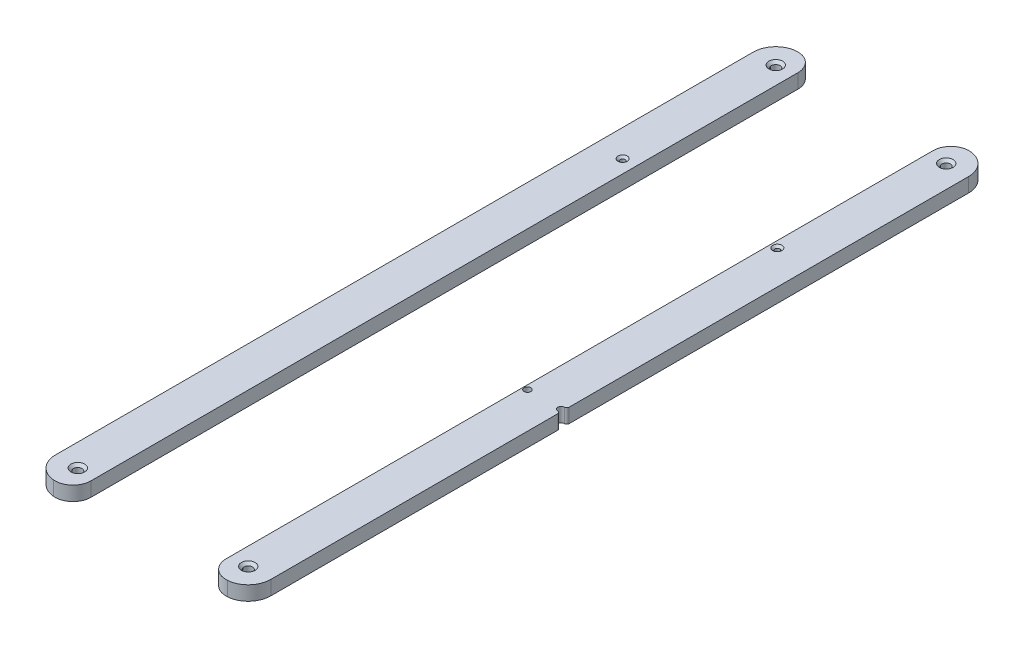
from build123d import *

# Parameters (mm, degrees)
SKETCH2_W                        = 150
SKETCH2_H                        = 330
SKETCH2_R                        = 2
BOSS_EXTRUDE1_DEPTH              = 6.35
SKETCH4_R                        = 7
SKETCH4_R_2                      = 1.5
CUT_EXTRUDE1_DEPTH               = 182.356892618
SKETCH7_R                        = 1.5
CUT_EXTRUDE2_DEPTH               = 10
SKETCH8_OUTSIDE_W                = 224.51
SKETCH8_OUTSIDE_H                = 404.51
SKETCH8_OUTSIDE_R                = 2
SKETCH8_OUTSIDE_R_2              = 7
SKETCH8_OUTSIDE_R_3              = 1.5
CUT_EXTRUDE3_DEPTH               = 10
FILLET2_R                        = 8
CUT_EXTRUDE7_DEPTH               = 10
SKETCH20_R                       = 1.5
CUT_EXTRUDE12_DEPTH              = 36.83
SKETCH18_R                       = 1.35
CUT_EXTRUDE10_DEPTH              = 36.83
CUT_EXTRUDE11_DEPTH              = 36.83
SKETCH21_OUTSIDE_W               = 204.398
SKETCH21_OUTSIDE_H               = 403.048
SKETCH21_OUTSIDE_W_2             = 95.7
SKETCH21_OUTSIDE_H_2             = 330
CUT_EXTRUDE13_DEPTH              = 182.356892618
F_4_40_TAPPED_HOLE1_D            = 2.2606
F_4_40_TAPPED_HOLE1_CSINK_D      = 4.1148
F_4_40_TAPPED_HOLE1_CSINK_ANGLE  = 90
F_4_40_TAPPED_HOLE2_D            = 2.2606
F_4_40_TAPPED_HOLE2_CSINK_D      = 4.1148
F_4_40_TAPPED_HOLE2_CSINK_ANGLE  = 90
FILLET11_R                       = 10
F_10_24_TAPPED_HOLE2_D           = 3.7973
F_10_24_TAPPED_HOLE2_CSINK_D     = 6.096
F_10_24_TAPPED_HOLE2_CSINK_ANGLE = 90
FILLET14_R                       = 1
SKETCH35_W                       = 60
SKETCH35_H                       = 330
CUT_EXTRUDE16_DEPTH              = 172.915517043
FILLET15_R                       = 8
FILLET16_R                       = 8


with BuildPart() as part:
    # Sketch2 → Boss-Extrude1 (new body)
    with BuildSketch(Plane(origin=(0, 0, 0), x_dir=(1, 0, 0), z_dir=(0, 1, 0))):
        Rectangle(SKETCH2_W, SKETCH2_H)
        with Locations((-50, 129.505)):
            Circle(SKETCH2_R, mode=Mode.SUBTRACT)
        with Locations((50, 129.505)):
            Circle(SKETCH2_R, mode=Mode.SUBTRACT)
        with Locations((50, 64.505)):
            Circle(SKETCH2_R, mode=Mode.SUBTRACT)
        with Locations((-50, 64.505)):
            Circle(SKETCH2_R, mode=Mode.SUBTRACT)
        with Locations((50, -129.505)):
            Circle(SKETCH2_R, mode=Mode.SUBTRACT)
        with Locations((-50, -129.505)):
            Circle(SKETCH2_R, mode=Mode.SUBTRACT)
        with Locations((-50, -64.505)):
            Circle(SKETCH2_R, mode=Mode.SUBTRACT)
        with Locations((50, -64.505)):
            Circle(SKETCH2_R, mode=Mode.SUBTRACT)
    extrude(amount=BOSS_EXTRUDE1_DEPTH)

    # Sketch4 → Cut-Extrude1 (cut, through all)
    with BuildSketch(Plane(origin=(0, 6.35, 0), x_dir=(1, 0, 0), z_dir=(0, 1, 0))):
        with Locations((1.85, -25)):
            Circle(SKETCH4_R)
        with Locations((-1.15, 25)):
            Circle(SKETCH4_R)
        with Locations((-4.15, 75)):
            Circle(SKETCH4_R)
        with Locations((-7.15, 125)):
            Circle(SKETCH4_R)
        with Locations((13, -70)):
            Circle(SKETCH4_R_2)
        with Locations((16, -90)):
            Circle(SKETCH4_R_2)
        with Locations((19, -110)):
            Circle(SKETCH4_R_2)
        with Locations((22, -130)):
            Circle(SKETCH4_R_2)
    extrude(amount=-CUT_EXTRUDE1_DEPTH, mode=Mode.SUBTRACT)

    # Sketch7 → Cut-Extrude2 (cut)
    with BuildSketch(Plane(origin=(0, 6.35, 0), x_dir=(1, 0, 0), z_dir=(0, 1, 0))):
        with Locations((31.85, -25)):
            Circle(SKETCH7_R)
        with Locations((46.85, -25)):
            Circle(SKETCH7_R)
        with Locations((61.85, -25)):
            Circle(SKETCH7_R)
    extrude(amount=-CUT_EXTRUDE2_DEPTH, mode=Mode.SUBTRACT)

    # Sketch8 outside → Cut-Extrude3 (cut)
    # profile 1 of 20: a face of its own
    with BuildSketch(Plane(origin=(0, 6.35, 0), x_dir=(1, 0, 0), z_dir=(0, 1, 0))):
        Rectangle(SKETCH8_OUTSIDE_W, SKETCH8_OUTSIDE_H)
        Polygon((-56.35, 165), (-56.35, -165), (56.35, -165), (56.35, -42.5), (75, -42.5), (75, -7.5), (56.35, -7.5), (56.35, 165), align=None, mode=Mode.SUBTRACT)
    # profile 2 of 20: a face of its own
    with BuildSketch(Plane(origin=(0, 6.35, 0), x_dir=(1, 0, 0), z_dir=(0, 1, 0))):
        with Locations((-50, -129.505)):
            Circle(SKETCH8_OUTSIDE_R)
    # profile 3 of 20: a face of its own
    with BuildSketch(Plane(origin=(0, 6.35, 0), x_dir=(1, 0, 0), z_dir=(0, 1, 0))):
        with Locations((-50, -64.505)):
            Circle(SKETCH8_OUTSIDE_R)
    # profile 4 of 20: a face of its own
    with BuildSketch(Plane(origin=(0, 6.35, 0), x_dir=(1, 0, 0), z_dir=(0, 1, 0))):
        with Locations((1.85, -25)):
            Circle(SKETCH8_OUTSIDE_R_2)
    # profile 5 of 20: a face of its own
    with BuildSketch(Plane(origin=(0, 6.35, 0), x_dir=(1, 0, 0), z_dir=(0, 1, 0))):
        with Locations((22, -130)):
            Circle(SKETCH8_OUTSIDE_R_3)
    # profile 6 of 20: a face of its own
    with BuildSketch(Plane(origin=(0, 6.35, 0), x_dir=(1, 0, 0), z_dir=(0, 1, 0))):
        with Locations((19, -110)):
            Circle(SKETCH8_OUTSIDE_R_3)
    # profile 7 of 20: a face of its own
    with BuildSketch(Plane(origin=(0, 6.35, 0), x_dir=(1, 0, 0), z_dir=(0, 1, 0))):
        with Locations((16, -90)):
            Circle(SKETCH8_OUTSIDE_R_3)
    # profile 8 of 20: a face of its own
    with BuildSketch(Plane(origin=(0, 6.35, 0), x_dir=(1, 0, 0), z_dir=(0, 1, 0))):
        with Locations((50, -129.505)):
            Circle(SKETCH8_OUTSIDE_R)
    # profile 9 of 20: a face of its own
    with BuildSketch(Plane(origin=(0, 6.35, 0), x_dir=(1, 0, 0), z_dir=(0, 1, 0))):
        with Locations((13, -70)):
            Circle(SKETCH8_OUTSIDE_R_3)
    # profile 10 of 20: a face of its own
    with BuildSketch(Plane(origin=(0, 6.35, 0), x_dir=(1, 0, 0), z_dir=(0, 1, 0))):
        with Locations((50, -64.505)):
            Circle(SKETCH8_OUTSIDE_R)
    # profile 11 of 20: a face of its own
    with BuildSketch(Plane(origin=(0, 6.35, 0), x_dir=(1, 0, 0), z_dir=(0, 1, 0))):
        with Locations((-50, 64.505)):
            Circle(SKETCH8_OUTSIDE_R)
    # profile 12 of 20: a face of its own
    with BuildSketch(Plane(origin=(0, 6.35, 0), x_dir=(1, 0, 0), z_dir=(0, 1, 0))):
        with Locations((-1.15, 25)):
            Circle(SKETCH8_OUTSIDE_R_2)
    # profile 13 of 20: a face of its own
    with BuildSketch(Plane(origin=(0, 6.35, 0), x_dir=(1, 0, 0), z_dir=(0, 1, 0))):
        with Locations((-4.15, 75)):
            Circle(SKETCH8_OUTSIDE_R_2)
    # profile 14 of 20: a face of its own
    with BuildSketch(Plane(origin=(0, 6.35, 0), x_dir=(1, 0, 0), z_dir=(0, 1, 0))):
        with Locations((-50, 129.505)):
            Circle(SKETCH8_OUTSIDE_R)
    # profile 15 of 20: a face of its own
    with BuildSketch(Plane(origin=(0, 6.35, 0), x_dir=(1, 0, 0), z_dir=(0, 1, 0))):
        with Locations((-7.15, 125)):
            Circle(SKETCH8_OUTSIDE_R_2)
    # profile 16 of 20: a face of its own
    with BuildSketch(Plane(origin=(0, 6.35, 0), x_dir=(1, 0, 0), z_dir=(0, 1, 0))):
        with Locations((50, 64.505)):
            Circle(SKETCH8_OUTSIDE_R)
    # profile 17 of 20: a face of its own
    with BuildSketch(Plane(origin=(0, 6.35, 0), x_dir=(1, 0, 0), z_dir=(0, 1, 0))):
        with Locations((50, 129.505)):
            Circle(SKETCH8_OUTSIDE_R)
    # profile 18 of 20: a face of its own
    with BuildSketch(Plane(origin=(0, 6.35, 0), x_dir=(1, 0, 0), z_dir=(0, 1, 0))):
        with Locations((31.85, -25)):
            Circle(SKETCH8_OUTSIDE_R_3)
    # profile 19 of 20: a face of its own
    with BuildSketch(Plane(origin=(0, 6.35, 0), x_dir=(1, 0, 0), z_dir=(0, 1, 0))):
        with Locations((46.85, -25)):
            Circle(SKETCH8_OUTSIDE_R_3)
    # profile 20 of 20: a face of its own
    with BuildSketch(Plane(origin=(0, 6.35, 0), x_dir=(1, 0, 0), z_dir=(0, 1, 0))):
        with Locations((61.85, -25)):
            Circle(SKETCH8_OUTSIDE_R_3)
    extrude(amount=-CUT_EXTRUDE3_DEPTH, mode=Mode.SUBTRACT)

    # Fillet2
    fillet2_edges = [part.edges().sort_by_distance(p)[0] for p in [
        (-56.35, 3.175, 165),
        (56.35, 3.175, 165),
        (-56.35, 3.175, -165),
        (56.35, 3.175, -165),
        (56.35, 3.175, 7.5),
        (75, 3.175, 7.5),
        (56.35, 3.175, 42.5),
        (75, 3.175, 42.5),
    ]]
    fillet(fillet2_edges, radius=FILLET2_R)

    # Sketch15 → Cut-Extrude7 (cut)
    with BuildSketch(Plane(origin=(0, 6.35, 0), x_dir=(1, 0, 0), z_dir=(0, 1, 0))):
        with BuildLine():
            Line((-52, -134.505), (-52, -124.505))
            ThreePointArc((-52, -124.505), (-50, -122.505), (-48, -124.505))
            Line((-48, -124.505), (-48, -134.505))
            ThreePointArc((-48, -134.505), (-50, -136.505), (-52, -134.505))
        make_face()
        with BuildLine():
            Line((48, -134.505), (48, -124.505))
            ThreePointArc((48, -124.505), (50, -122.505), (52, -124.505))
            Line((52, -124.505), (52, -134.505))
            ThreePointArc((52, -134.505), (50, -136.505), (48, -134.505))
        make_face()
        with BuildLine():
            Line((48, -69.505), (48, -59.505))
            ThreePointArc((48, -59.505), (50, -57.505), (52, -59.505))
            Line((52, -59.505), (52, -69.505))
            ThreePointArc((52, -69.505), (50, -71.505), (48, -69.505))
        make_face()
        with BuildLine():
            Line((-52, -69.505), (-52, -59.505))
            ThreePointArc((-52, -59.505), (-50, -57.505), (-48, -59.505))
            Line((-48, -59.505), (-48, -69.505))
            ThreePointArc((-48, -69.505), (-50, -71.505), (-52, -69.505))
        make_face()
        with BuildLine():
            Line((-52, 134.505), (-52, 124.505))
            ThreePointArc((-52, 124.505), (-50, 122.505), (-48, 124.505))
            Line((-48, 124.505), (-48, 134.505))
            ThreePointArc((-48, 134.505), (-50, 136.505), (-52, 134.505))
        make_face()
        with BuildLine():
            Line((48, 134.505), (48, 124.505))
            ThreePointArc((48, 124.505), (50, 122.505), (52, 124.505))
            Line((52, 124.505), (52, 134.505))
            ThreePointArc((52, 134.505), (50, 136.505), (48, 134.505))
        make_face()
        with BuildLine():
            Line((48, 69.505), (48, 59.505))
            ThreePointArc((48, 59.505), (50, 57.505), (52, 59.505))
            Line((52, 59.505), (52, 69.505))
            ThreePointArc((52, 69.505), (50, 71.505), (48, 69.505))
        make_face()
        with BuildLine():
            Line((-52, 69.505), (-52, 59.505))
            ThreePointArc((-52, 59.505), (-50, 57.505), (-48, 59.505))
            Line((-48, 59.505), (-48, 69.505))
            ThreePointArc((-48, 69.505), (-50, 71.505), (-52, 69.505))
        make_face()
    extrude(amount=-CUT_EXTRUDE7_DEPTH, mode=Mode.SUBTRACT)

    # Sketch20 → Cut-Extrude12 (cut)
    with BuildSketch(Plane(origin=(0, 6.35, 0), x_dir=(1, 0, 0), z_dir=(0, 1, 0))):
        with Locations((-50, -144.505)):
            Circle(SKETCH20_R)
        with Locations((-50, -79.505)):
            Circle(SKETCH20_R)
        with Locations((50, -79.505)):
            Circle(SKETCH20_R)
        with Locations((50, -144.505)):
            Circle(SKETCH20_R)
        with Locations((50, 144.505)):
            Circle(SKETCH20_R)
        with Locations((50, 79.505)):
            Circle(SKETCH20_R)
        with Locations((-50, 79.505)):
            Circle(SKETCH20_R)
        with Locations((-50, 144.505)):
            Circle(SKETCH20_R)
    extrude(amount=-CUT_EXTRUDE12_DEPTH, mode=Mode.SUBTRACT)

    # Sketch18 → Cut-Extrude10 (cut)
    with BuildSketch(Plane(origin=(0, 6.35, 0), x_dir=(1, 0, 0), z_dir=(0, 1, 0))):
        with Locations((14.35, -33.5)):
            Circle(SKETCH18_R)
        with Locations((-10.65, -33.5)):
            Circle(SKETCH18_R)
        with Locations((14.35, -4.5)):
            Circle(SKETCH18_R)
        with Locations((-10.65, -4.5)):
            Circle(SKETCH18_R)
        with Locations((-13.65, 16.5)):
            Circle(SKETCH18_R)
        with Locations((-13.65, 45.5)):
            Circle(SKETCH18_R)
        with Locations((-16.65, 66.5)):
            Circle(SKETCH18_R)
        with Locations((-16.65, 95.5)):
            Circle(SKETCH18_R)
        with Locations((-19.65, 116.5)):
            Circle(SKETCH18_R)
        with Locations((-19.65, 145.5)):
            Circle(SKETCH18_R)
    extrude(amount=-CUT_EXTRUDE10_DEPTH, mode=Mode.SUBTRACT)

    # Sketch19 → Cut-Extrude11 (cut)
    with BuildSketch(Plane(origin=(0, 6.35, 0), x_dir=(1, 0, 0), z_dir=(0, 1, 0))):
        with BuildLine():
            Line((-12, -33.5), (-12, -18.5))
            ThreePointArc((-12, -18.5), (-10.65, -17.15), (-9.3, -18.5))
            Line((-9.3, -18.5), (-9.3, -33.5))
            ThreePointArc((-9.3, -33.5), (-10.65, -34.85), (-12, -33.5))
        make_face()
        with BuildLine():
            Line((-12, -4.5), (-12, 10.5))
            ThreePointArc((-12, 10.5), (-10.65, 11.85), (-9.3, 10.5))
            Line((-9.3, 10.5), (-9.3, -4.5))
            ThreePointArc((-9.3, -4.5), (-10.65, -5.85), (-12, -4.5))
        make_face()
        with BuildLine():
            Line((-15, 16.5), (-15, 31.5))
            ThreePointArc((-15, 31.5), (-13.65, 32.85), (-12.3, 31.5))
            Line((-12.3, 31.5), (-12.3, 16.5))
            ThreePointArc((-12.3, 16.5), (-13.65, 15.15), (-15, 16.5))
        make_face()
        with BuildLine():
            Line((-15, 45.5), (-15, 60.5))
            ThreePointArc((-15, 60.5), (-13.65, 61.85), (-12.3, 60.5))
            Line((-12.3, 60.5), (-12.3, 45.5))
            ThreePointArc((-12.3, 45.5), (-13.65, 44.15), (-15, 45.5))
        make_face()
        with BuildLine():
            Line((-18, 66.5), (-18, 81.5))
            ThreePointArc((-18, 81.5), (-16.65, 82.85), (-15.3, 81.5))
            Line((-15.3, 81.5), (-15.3, 66.5))
            ThreePointArc((-15.3, 66.5), (-16.65, 65.15), (-18, 66.5))
        make_face()
        with BuildLine():
            Line((-18, 95.5), (-18, 110.5))
            ThreePointArc((-18, 110.5), (-16.65, 111.85), (-15.3, 110.5))
            Line((-15.3, 110.5), (-15.3, 95.5))
            ThreePointArc((-15.3, 95.5), (-16.65, 94.15), (-18, 95.5))
        make_face()
        with BuildLine():
            Line((-21, 116.5), (-21, 131.5))
            ThreePointArc((-21, 131.5), (-19.65, 132.85), (-18.3, 131.5))
            Line((-18.3, 131.5), (-18.3, 116.5))
            ThreePointArc((-18.3, 116.5), (-19.65, 115.15), (-21, 116.5))
        make_face()
        with BuildLine():
            Line((-21, 145.5), (-21, 160.5))
            ThreePointArc((-21, 160.5), (-19.65, 161.85), (-18.3, 160.5))
            Line((-18.3, 160.5), (-18.3, 145.5))
            ThreePointArc((-18.3, 145.5), (-19.65, 144.15), (-21, 145.5))
        make_face()
        with BuildLine():
            Line((15.7, -4.5), (15.7, 10.5))
            ThreePointArc((15.7, 10.5), (14.35, 11.85), (13, 10.5))
            Line((13, 10.5), (13, -4.5))
            ThreePointArc((13, -4.5), (14.35, -5.85), (15.7, -4.5))
        make_face()
        with BuildLine():
            Line((15.7, -33.5), (15.7, -18.5))
            ThreePointArc((15.7, -18.5), (14.35, -17.15), (13, -18.5))
            Line((13, -18.5), (13, -33.5))
            ThreePointArc((13, -33.5), (14.35, -34.85), (15.7, -33.5))
        make_face()
        with BuildLine():
            Line((12.7, 45.5), (12.7, 60.5))
            ThreePointArc((12.7, 60.5), (11.35, 61.85), (10, 60.5))
            Line((10, 60.5), (10, 45.5))
            ThreePointArc((10, 45.5), (11.35, 44.15), (12.7, 45.5))
        make_face()
        with BuildLine():
            Line((12.7, 16.5), (12.7, 31.5))
            ThreePointArc((12.7, 31.5), (11.35, 32.85), (10, 31.5))
            Line((10, 31.5), (10, 16.5))
            ThreePointArc((10, 16.5), (11.35, 15.15), (12.7, 16.5))
        make_face()
        with BuildLine():
            Line((9.7, 95.5), (9.7, 110.5))
            ThreePointArc((9.7, 110.5), (8.35, 111.85), (7, 110.5))
            Line((7, 110.5), (7, 95.5))
            ThreePointArc((7, 95.5), (8.35, 94.15), (9.7, 95.5))
        make_face()
        with BuildLine():
            Line((9.7, 66.5), (9.7, 81.5))
            ThreePointArc((9.7, 81.5), (8.35, 82.85), (7, 81.5))
            Line((7, 81.5), (7, 66.5))
            ThreePointArc((7, 66.5), (8.35, 65.15), (9.7, 66.5))
        make_face()
        with BuildLine():
            Line((6.7, 145.5), (6.7, 160.5))
            ThreePointArc((6.7, 160.5), (5.35, 161.85), (4, 160.5))
            Line((4, 160.5), (4, 145.5))
            ThreePointArc((4, 145.5), (5.35, 144.15), (6.7, 145.5))
        make_face()
        with BuildLine():
            Line((6.7, 116.5), (6.7, 131.5))
            ThreePointArc((6.7, 131.5), (5.35, 132.85), (4, 131.5))
            Line((4, 131.5), (4, 116.5))
            ThreePointArc((4, 116.5), (5.35, 115.15), (6.7, 116.5))
        make_face()
        with BuildLine():
            Line((-5.15, -25), (-5.15, -10))
            ThreePointArc((-5.15, -10), (1.85, -3), (8.85, -10))
            Line((8.85, -10), (8.85, -25))
            ThreePointArc((8.85, -25), (1.85, -32), (-5.15, -25))
        make_face()
        with BuildLine():
            Line((-8.15, 25), (-8.15, 40))
            ThreePointArc((-8.15, 40), (-1.15, 47), (5.85, 40))
            Line((5.85, 40), (5.85, 25))
            ThreePointArc((5.85, 25), (-1.15, 18), (-8.15, 25))
        make_face()
        with BuildLine():
            Line((-11.15, 75), (-11.15, 89))
            ThreePointArc((-11.15, 89), (-4.15, 96), (2.85, 89))
            Line((2.85, 89), (2.85, 75))
            ThreePointArc((2.85, 75), (-4.15, 68), (-11.15, 75))
        make_face()
        with BuildLine():
            Line((-14.15, 125), (-14.15, 139))
            ThreePointArc((-14.15, 139), (-7.15, 146), (-0.15, 139))
            Line((-0.15, 139), (-0.15, 125))
            ThreePointArc((-0.15, 125), (-7.15, 118), (-14.15, 125))
        make_face()
    extrude(amount=-CUT_EXTRUDE11_DEPTH, mode=Mode.SUBTRACT)

    # Sketch21 outside → Cut-Extrude13 (cut, through all)
    with BuildSketch(Plane(origin=(0, 6.35, 0), x_dir=(1, 0, 0), z_dir=(0, 1, 0))):
        with Locations((9.325, 0)):
            Rectangle(SKETCH21_OUTSIDE_W, SKETCH21_OUTSIDE_H)
        Rectangle(SKETCH21_OUTSIDE_W_2, SKETCH21_OUTSIDE_H_2, mode=Mode.SUBTRACT)
    extrude(amount=-CUT_EXTRUDE13_DEPTH, mode=Mode.SUBTRACT)

    # #4-40 Tapped Hole1 (through all)
    with Locations(Plane(origin=(0, 6.35, 0), x_dir=(1, 0, 0), z_dir=(0, 1, 0))):
        with Locations((-35.85, 85), (32.85, 85)):
            CounterSinkHole(F_4_40_TAPPED_HOLE1_D / 2, F_4_40_TAPPED_HOLE1_CSINK_D / 2, counter_sink_angle=F_4_40_TAPPED_HOLE1_CSINK_ANGLE)

    # #4-40 Tapped Hole2 (through all)
    with Locations(Plane(origin=(0, 6.35, 0), x_dir=(1, 0, 0), z_dir=(0, 1, 0))):
        with Locations((0, -145), (0, -65), (0, -105)):
            CounterSinkHole(F_4_40_TAPPED_HOLE2_D / 2, F_4_40_TAPPED_HOLE2_CSINK_D / 2, counter_sink_angle=F_4_40_TAPPED_HOLE2_CSINK_ANGLE)

    # Fillet11
    fillet11_edges = [part.edges().sort_by_distance(p)[0] for p in [
        (-47.85, 3.175, -165),
        (47.85, 3.175, 165),
        (47.85, 3.175, -165),
        (-47.85, 3.175, 165),
    ]]
    fillet(fillet11_edges, radius=FILLET11_R)

    # #10-24 Tapped Hole2 (through all)
    with Locations(Plane(origin=(0, 6.35, 0), x_dir=(1, 0, 0), z_dir=(0, 1, 0))):
        with Locations((-37.85, -155), (37.85, -155), (37.85, 155), (-37.85, 155)):
            CounterSinkHole(F_10_24_TAPPED_HOLE2_D / 2, F_10_24_TAPPED_HOLE2_CSINK_D / 2, counter_sink_angle=F_10_24_TAPPED_HOLE2_CSINK_ANGLE)

    # Fillet14
    fillet14_edges = [part.edges().sort_by_distance(p)[0] for p in [
        (47.85, 3.175, 26.118033989),
        (47.85, 3.175, 23.881966011),
    ]]
    fillet(fillet14_edges, radius=FILLET14_R)

    # Sketch35 → Cut-Extrude16 (cut, through all)
    with BuildSketch(Plane(origin=(0, 0, 0), x_dir=(1, 0, 0), z_dir=(0, 1, 0))):
        Rectangle(SKETCH35_W, SKETCH35_H)
    extrude(amount=CUT_EXTRUDE16_DEPTH, mode=Mode.SUBTRACT)


with BuildPart() as cut_extrude16_piece_1:
    # of the separate pieces the step leaves, piece 1, a body of its own (cut_extrude16_pieces)
    add(part.part.solids().sort_by_distance((-30, 6.35, 165))[0])

    # Fillet15
    fillet15_edges = [cut_extrude16_piece_1.edges().sort_by_distance(p)[0] for p in [
        (-30, 3.175, -165),
        (-30, 3.175, 165),
    ]]
    fillet(fillet15_edges, radius=FILLET15_R)


with BuildPart() as cut_extrude16_piece_2:
    # of the separate pieces the step leaves, piece 2, a body of its own (cut_extrude16_pieces)
    add(part.part.solids().sort_by_distance((47.85, 6.35, 27.5))[0])

    # Fillet16
    fillet16_edges = [cut_extrude16_piece_2.edges().sort_by_distance(p)[0] for p in [
        (30, 3.175, 165),
        (30, 3.175, -165),
    ]]
    fillet(fillet16_edges, radius=FILLET16_R)


solid = Compound([cut_extrude16_piece_1.part, cut_extrude16_piece_2.part])
